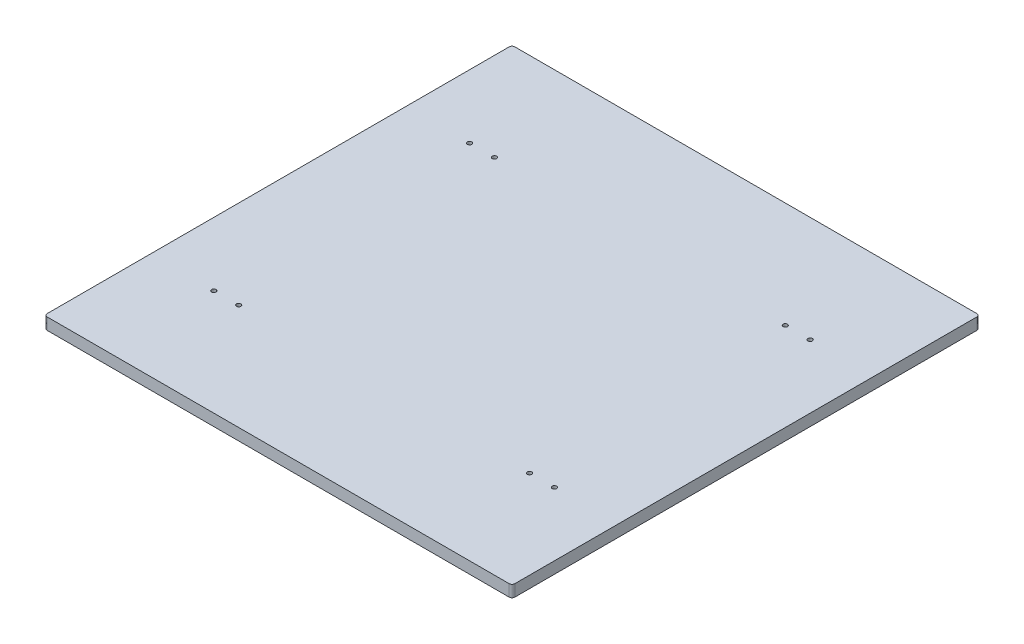
from build123d import *

# Parameters (mm, degrees)
EXTRUDE_1_DEPTH    = 8
SKETCH2_R          = 1.5
CUT_EXTRUDE1_DEPTH = 227.415547169


with BuildPart() as part:
    # 草图1 → 凸台-拉伸1 (new body)
    with BuildSketch(Plane(origin=(0, 0, 0), x_dir=(1, 0, 0), z_dir=(0, 1, 0))):
        with BuildLine():
            Line((-158, -160), (158, -160))
            ThreePointArc((158, -160), (159.414213562, -159.414213562), (160, -158))
            Line((160, -158), (160, 158))
            ThreePointArc((160, 158), (159.414213562, 159.414213562), (158, 160))
            Line((158, 160), (-158, 160))
            ThreePointArc((-158, 160), (-159.414213562, 159.414213562), (-160, 158))
            Line((-160, 158), (-160, -158))
            ThreePointArc((-160, -158), (-159.414213562, -159.414213562), (-158, -160))
        make_face()
    extrude(amount=-EXTRUDE_1_DEPTH)

    # Sketch2 → Cut-Extrude1 (cut, through all)
    with BuildSketch(Plane.XZ.offset(8)):
        with Locations((-116.5, 87.5)):
            Circle(SKETCH2_R)
        with Locations((-99.5, 87.5)):
            Circle(SKETCH2_R)
        with Locations((-116.5, -87.5)):
            Circle(SKETCH2_R)
        with Locations((-99.5, -87.5)):
            Circle(SKETCH2_R)
        with Locations((99.5, -87.5)):
            Circle(SKETCH2_R)
        with Locations((116.5, -87.5)):
            Circle(SKETCH2_R)
        with Locations((99.5, 87.5)):
            Circle(SKETCH2_R)
        with Locations((116.5, 87.5)):
            Circle(SKETCH2_R)
    extrude(amount=-CUT_EXTRUDE1_DEPTH, mode=Mode.SUBTRACT)


solid = part.part
